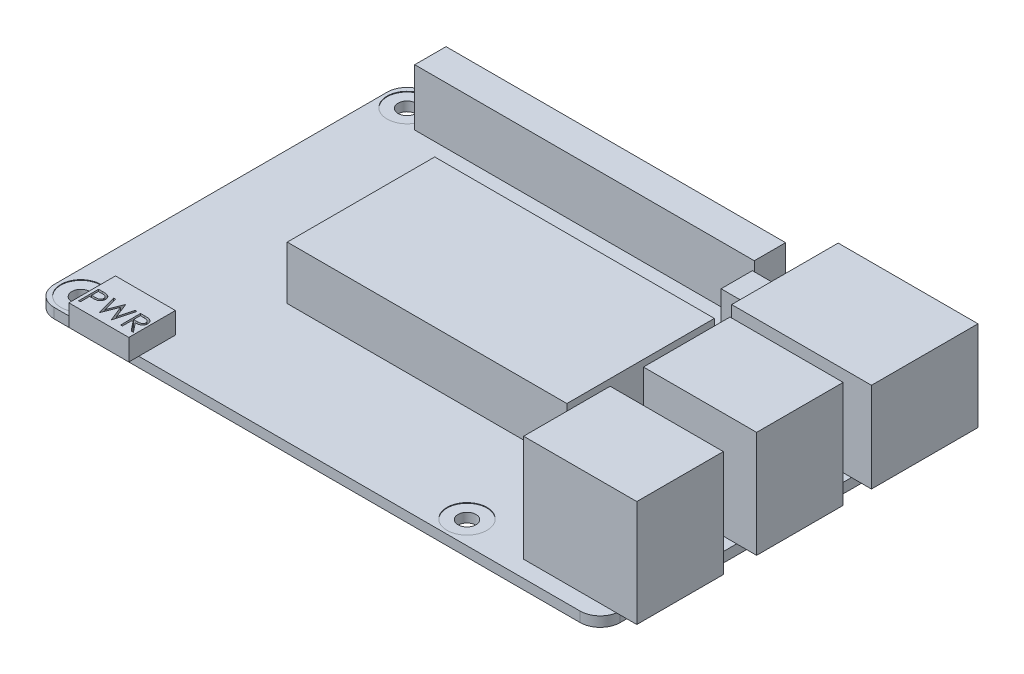
from build123d import *

# Parameters (mm, degrees)
SKETCH1_W           = 85
SKETCH1_H           = 56
SKETCH1_R           = 1.35
BOSS_EXTRUDE1_DEPTH = 1.5
FILLET1_R           = 3
SKETCH2_W           = 17
SKETCH2_H           = 13
BOSS_EXTRUDE2_DEPTH = 16
SKETCH3_W           = 21
SKETCH3_H           = 16
BOSS_EXTRUDE3_DEPTH = 13.5
SKETCH4_W           = 51
SKETCH4_H           = 4.7
SKETCH4_W_2         = 4.7
BOSS_EXTRUDE4_DEPTH = 8.5
SKETCH5_W           = 9
SKETCH5_H           = 7
BOSS_EXTRUDE5_DEPTH = 3.2
CUT_EXTRUDE1_DEPTH  = 1
SKETCH7_W           = 42
SKETCH7_H           = 22.15
BOSS_EXTRUDE6_DEPTH = 8
SKETCH9_R           = 3
CUT_EXTRUDE2_DEPTH  = 0.1


with BuildPart() as part:
    # Sketch1 → Boss-Extrude1 (new body)
    with BuildSketch(Plane(origin=(0, 0, 0), x_dir=(1, 0, 0), z_dir=(0, 1, 0))):
        with Locations((42.5, 28)):
            Rectangle(SKETCH1_W, SKETCH1_H)
        with Locations((3.5, 52.5)):
            Circle(SKETCH1_R, mode=Mode.SUBTRACT)
        with Locations((3.5, 3.5)):
            Circle(SKETCH1_R, mode=Mode.SUBTRACT)
        with Locations((61.5, 3.5)):
            Circle(SKETCH1_R, mode=Mode.SUBTRACT)
        with Locations((61.5, 52.5)):
            Circle(SKETCH1_R, mode=Mode.SUBTRACT)
    extrude(amount=BOSS_EXTRUDE1_DEPTH)

    # Fillet1
    fillet1_edges = [part.edges().sort_by_distance(p)[0] for p in [
        (85, 0.75, -56),
        (85, 0.75, 0),
        (0, 0.75, -56),
        (0, 0.75, 0),
    ]]
    fillet(fillet1_edges, radius=FILLET1_R)

    # Sketch2 → Boss-Extrude2 (add)
    with BuildSketch(Plane(origin=(0, 1.5, 0), x_dir=(1, 0, 0), z_dir=(0, 1, 0))):
        with Locations((79.5, 27)):
            Rectangle(SKETCH2_W, SKETCH2_H)
        with Locations((79.5, 9)):
            Rectangle(SKETCH2_W, SKETCH2_H)
    extrude(amount=BOSS_EXTRUDE2_DEPTH)

    # Sketch3 → Boss-Extrude3 (add)
    with BuildSketch(Plane(origin=(0, 1.5, 0), x_dir=(1, 0, 0), z_dir=(0, 1, 0))):
        with Locations((77.5, 45.75)):
            Rectangle(SKETCH3_W, SKETCH3_H)
    extrude(amount=BOSS_EXTRUDE3_DEPTH)

    # Sketch4 → Boss-Extrude4 (add)
    with BuildSketch(Plane(origin=(0, 1.5, 0), x_dir=(1, 0, 0), z_dir=(0, 1, 0))):
        with Locations((32.5, 52.5)):
            Rectangle(SKETCH4_W, SKETCH4_H)
        with Locations((61.5, 46.36)):
            Rectangle(SKETCH4_W_2, SKETCH4_H)
    extrude(amount=BOSS_EXTRUDE4_DEPTH)

    # Sketch5 → Boss-Extrude5 (add)
    with BuildSketch(Plane(origin=(0, 1.5, 0), x_dir=(1, 0, 0), z_dir=(0, 1, 0))):
        with Locations((11.2, 2)):
            Rectangle(SKETCH5_W, SKETCH5_H)
    extrude(amount=BOSS_EXTRUDE5_DEPTH)

    # Sketch6 → Cut-Extrude1 (cut)
    # profile 1 of 3: a face of its own
    with BuildSketch(Plane(origin=(0, 4.7, 0), x_dir=(1, 0, 0), z_dir=(0, 1, 0))):
        with BuildLine():
            Line((7.161538462, 2.5), (7.749879808, 2.5))
            add(Edge.make_bspline(
                [(7.749879808, 2.5), (7.790346299, 2.499955518), (7.867881893, 2.499870287), (7.979066226, 2.497286219), (8.080045996, 2.493834769), (8.170603465, 2.489050289), (8.251017264, 2.483396069), (8.32092352, 2.475465749), (8.380871712, 2.467185496), (8.416791525, 2.458767148), (8.433173077, 2.454927885)],
                knots=[0, 0, 0, 0, 1.415646017, 2.712440637, 3.8905458, 4.950247383, 5.884950622, 6.709939814, 7.411656543, 8, 8, 8, 8], degree=3))
            add(Edge.make_bspline(
                [(8.433173077, 2.454927885), (8.453910392, 2.449251928), (8.494896372, 2.43803376), (8.553954409, 2.415564855), (8.610143419, 2.388922999), (8.663656184, 2.358559622), (8.713835112, 2.323171995), (8.761428862, 2.284194609), (8.806017416, 2.24072755), (8.847350038, 2.193258344), (8.885308436, 2.142583879), (8.917991021, 2.087947682), (8.945357215, 2.030269422), (8.968828591, 1.969589218), (8.985721552, 1.905397512), (8.998447466, 1.83814033), (9.006524861, 1.767824881), (9.007298485, 1.719773566), (9.007692308, 1.6953125)],
                knots=[0, 0, 0, 0, 0.999701418, 1.975846123, 2.934577507, 3.890451536, 4.834027766, 5.787354733, 6.749476667, 7.726910423, 8.712836071, 9.690891519, 10.682875813, 11.679750201, 12.712814741, 13.765529915, 14.8625177, 16, 16, 16, 16], degree=3))
            add(Edge.make_bspline(
                [(9.007692308, 1.6953125), (9.007331086, 1.670645834), (9.006624333, 1.622383837), (8.998141803, 1.551778589), (8.986715924, 1.484305684), (8.969147022, 1.420114726), (8.946136445, 1.359586923), (8.919143257, 1.301797295), (8.886585945, 1.247729005), (8.849176091, 1.197185762), (8.807560439, 1.150120122), (8.761915063, 1.106873156), (8.712424241, 1.067698009), (8.659245257, 1.032506857), (8.601859672, 1.00211576), (8.541137826, 0.974895213), (8.476551927, 0.952034304), (8.431858343, 0.940008537), (8.409134615, 0.933894231)],
                knots=[0, 0, 0, 0, 1.121902311, 2.195077645, 3.232258892, 4.234102512, 5.217864754, 6.176164875, 7.132989551, 8.084763148, 9.034132444, 9.988522005, 10.94243251, 11.903244335, 12.886203696, 13.894208494, 14.929344452, 16, 16, 16, 16], degree=3))
            add(Edge.make_bspline(
                [(8.409134615, 0.933894231), (8.390339758, 0.92989739), (8.349149734, 0.921138081), (8.281313115, 0.911359403), (8.202331356, 0.903012888), (8.112312259, 0.89675477), (8.011336626, 0.891397312), (7.899349834, 0.887138946), (7.776132054, 0.884799071), (7.690185273, 0.884678391), (7.6453125, 0.884615385)],
                knots=[0, 0, 0, 0, 0.601384939, 1.31797006, 2.144135048, 3.087295005, 4.142315834, 5.309527816, 6.595305764, 8, 8, 8, 8], degree=3))
            Line((7.6453125, 0.884615385), (7.430769231, 0.884615385))
            Line((7.430769231, 0.884615385), (7.430769231, -0.5))
            Line((7.430769231, -0.5), (7.161538462, -0.5))
            Line((7.161538462, -0.5), (7.161538462, 2.5))
        make_face()
        with BuildLine():
            Line((7.430769231, 2.192307692), (7.430769231, 1.192307692))
            Line((7.430769231, 1.192307692), (7.956009615, 1.185697115))
            add(Edge.make_bspline(
                [(7.956009615, 1.185697115), (7.981655266, 1.185683861), (8.031163666, 1.185658273), (8.102680429, 1.189074179), (8.169031246, 1.193017493), (8.230012311, 1.198791142), (8.285651112, 1.206952219), (8.336040423, 1.215190852), (8.380789522, 1.227109734), (8.433160267, 1.243158079), (8.491517422, 1.270528893), (8.555003892, 1.31025737), (8.608807251, 1.360897977), (8.655365791, 1.417836118), (8.692313687, 1.481178229), (8.71936168, 1.548951603), (8.735254101, 1.620461188), (8.737385124, 1.669393879), (8.738461538, 1.694110577)],
                knots=[0, 0, 0, 0, 1.160613943, 2.240541288, 3.23993089, 4.169200891, 5.011653406, 5.7853311, 6.478053781, 7.106038997, 8.262395093, 9.384106736, 10.481365981, 11.59014053, 12.70357646, 13.786202915, 14.881775077, 16, 16, 16, 16], degree=3))
            add(Edge.make_bspline(
                [(8.738461538, 1.694110577), (8.73737927, 1.718229303), (8.735227854, 1.766174345), (8.719237115, 1.836441854), (8.692366274, 1.903501029), (8.655117764, 1.966049388), (8.609911082, 2.022782648), (8.557368788, 2.0720659), (8.497614564, 2.111684502), (8.442030366, 2.137255887), (8.39265792, 2.15286898), (8.349773383, 2.163793129), (8.301352805, 2.172515077), (8.247380423, 2.179577508), (8.188274565, 2.185623332), (8.123527438, 2.189725598), (8.053384315, 2.192126846), (8.00468954, 2.192245951), (7.979447115, 2.192307692)],
                knots=[0, 0, 0, 0, 1.120700087, 2.227813068, 3.331159281, 4.466773991, 5.599788987, 6.693661531, 7.80175334, 8.91857717, 9.525282508, 10.207424825, 10.974604443, 11.810962634, 12.737642355, 13.736264703, 14.826523623, 16, 16, 16, 16], degree=3))
            Line((7.979447115, 2.192307692), (7.430769231, 2.192307692))
        make_face(mode=Mode.SUBTRACT)
    # profile 2 of 3: a face of its own
    with BuildSketch(Plane(origin=(0, 4.7, 0), x_dir=(1, 0, 0), z_dir=(0, 1, 0))):
        Polygon((9.430769231, 2.5), (9.709014423, 2.5), (10.296153846, 0.299879808), (11.169350962, 2.5), (11.208413462, 2.5), (12.065384615, 0.314903846), (12.655528846, 2.5), (12.930769231, 2.5), (12.121875, -0.5), (12.083413462, -0.5), (11.180769231, 1.794471154), (10.267307692, -0.5), (10.228846154, -0.5), align=None)
    # profile 3 of 3: a face of its own
    with BuildSketch(Plane(origin=(0, 4.7, 0), x_dir=(1, 0, 0), z_dir=(0, 1, 0))):
        with BuildLine():
            Line((13.469230769, 2.5), (14.069591346, 2.5))
            add(Edge.make_bspline(
                [(14.069591346, 2.5), (14.109655171, 2.499866641), (14.186582152, 2.499610576), (14.296787812, 2.498182779), (14.396925324, 2.494090474), (14.486942329, 2.490568831), (14.566837176, 2.484147167), (14.636854854, 2.47800947), (14.69667288, 2.469974903), (14.73288361, 2.462513112), (14.749278846, 2.459134615)],
                knots=[0, 0, 0, 0, 1.410062039, 2.707475311, 3.878576406, 4.937260626, 5.877586885, 6.699081471, 7.410979367, 8, 8, 8, 8], degree=3))
            add(Edge.make_bspline(
                [(14.749278846, 2.459134615), (14.771227381, 2.453711674), (14.814656229, 2.442981476), (14.877184857, 2.420301818), (14.936768564, 2.394056426), (14.993159842, 2.36323038), (15.046076234, 2.327594854), (15.096063358, 2.287765035), (15.14334804, 2.243958859), (15.186018009, 2.195071852), (15.226251482, 2.143783415), (15.26018459, 2.088323052), (15.289435859, 2.030327457), (15.312724873, 1.969206813), (15.331477422, 1.905553866), (15.344699913, 1.83879204), (15.352629502, 1.76922549), (15.353436807, 1.721775854), (15.353846154, 1.697716346)],
                knots=[0, 0, 0, 0, 1.027469482, 2.033020251, 3.019912614, 3.986113645, 4.951240523, 5.91722682, 6.890402269, 7.87763091, 8.8651537, 9.85103654, 10.82876324, 11.815024772, 12.821070561, 13.842952187, 14.906261191, 16, 16, 16, 16], degree=3))
            add(Edge.make_bspline(
                [(15.353846154, 1.697716346), (15.352587013, 1.657743399), (15.350130102, 1.579745827), (15.32722287, 1.466550786), (15.289700139, 1.360959945), (15.237994463, 1.263106255), (15.172149198, 1.17489713), (15.093013663, 1.097419597), (15.00054371, 1.032585386), (14.914461439, 0.98762584), (14.838420696, 0.958831918), (14.775820714, 0.938572182), (14.707534733, 0.922919069), (14.634217018, 0.908896098), (14.555562456, 0.898308932), (14.471759565, 0.890554708), (14.382748578, 0.885708381), (14.321600804, 0.884986662), (14.290144231, 0.884615385)],
                knots=[0, 0, 0, 0, 1.260483769, 2.459530307, 3.627416485, 4.787058657, 5.939039949, 7.08810263, 8.267026773, 9.491475466, 10.141966685, 10.831826277, 11.566392101, 12.351337768, 13.187381173, 14.07005841, 15.007169909, 16, 16, 16, 16], degree=3))
            Line((14.290144231, 0.884615385), (15.392307692, -0.5))
            Line((15.392307692, -0.5), (15.059375, -0.5))
            Line((15.059375, -0.5), (13.957211538, 0.884615385))
            Line((13.957211538, 0.884615385), (13.738461538, 0.884615385))
            Line((13.738461538, 0.884615385), (13.738461538, -0.5))
            Line((13.738461538, -0.5), (13.469230769, -0.5))
            Line((13.469230769, -0.5), (13.469230769, 2.5))
        make_face()
        with BuildLine():
            Line((13.738461538, 2.192307692), (13.738461538, 1.192307692))
            Line((13.738461538, 1.192307692), (14.287740385, 1.188100962))
            add(Edge.make_bspline(
                [(14.287740385, 1.188100962), (14.313386132, 1.188089616), (14.363094896, 1.188067625), (14.435009751, 1.191490861), (14.501969847, 1.195385134), (14.563719063, 1.201341716), (14.620284985, 1.209018349), (14.671639339, 1.218620907), (14.717865955, 1.229808389), (14.771778988, 1.247124068), (14.831981729, 1.274557798), (14.897408694, 1.314471083), (14.953124984, 1.364673185), (15.000197437, 1.422079005), (15.038022664, 1.485195789), (15.064690139, 1.553266963), (15.081612233, 1.624574047), (15.083608129, 1.673583854), (15.084615385, 1.698317308)],
                knots=[0, 0, 0, 0, 1.146690395, 2.22261258, 3.21895312, 4.145990853, 4.996080663, 5.770904154, 6.481378293, 7.121626537, 8.300444488, 9.431385265, 10.535395872, 11.636531494, 12.74115979, 13.810798291, 14.895190096, 16, 16, 16, 16], degree=3))
            add(Edge.make_bspline(
                [(15.084615385, 1.698317308), (15.083584995, 1.722442942), (15.081543139, 1.770251147), (15.064872766, 1.840241927), (15.036681868, 1.906299313), (14.998691378, 1.968154586), (14.952406388, 2.024302359), (14.898133977, 2.072342776), (14.837358096, 2.111985175), (14.780554211, 2.137317501), (14.729782029, 2.152848804), (14.685699464, 2.163778373), (14.635889625, 2.172559346), (14.580110661, 2.179594827), (14.518600692, 2.185641922), (14.451048705, 2.189714875), (14.377902893, 2.192126758), (14.327205524, 2.192245977), (14.300961538, 2.192307692)],
                knots=[0, 0, 0, 0, 1.101028733, 2.181837193, 3.264309656, 4.369019818, 5.486613113, 6.575447106, 7.666700264, 8.788928104, 9.402425223, 10.0903467, 10.862060571, 11.710948788, 12.657782767, 13.684531032, 14.801375019, 16, 16, 16, 16], degree=3))
            Line((14.300961538, 2.192307692), (13.738461538, 2.192307692))
        make_face(mode=Mode.SUBTRACT)
    extrude(amount=-CUT_EXTRUDE1_DEPTH, mode=Mode.SUBTRACT)

    # Sketch7 → Boss-Extrude6 (add)
    with BuildSketch(Plane(origin=(0, 1.5, 0), x_dir=(1, 0, 0), z_dir=(0, 1, 0))):
        with Locations((41, 29.075)):
            Rectangle(SKETCH7_W, SKETCH7_H)
    extrude(amount=BOSS_EXTRUDE6_DEPTH)

    # Sketch9 → Cut-Extrude2 (cut)
    with BuildSketch(Plane(origin=(0, 1.5, 0), x_dir=(1, 0, 0), z_dir=(0, 1, 0))):
        with Locations((3.5, 52.5)):
            Circle(SKETCH9_R)
        with Locations((3.5, 3.5)):
            Circle(SKETCH9_R)
        with Locations((61.5, 52.5)):
            Circle(SKETCH9_R)
        with Locations((61.5, 3.5)):
            Circle(SKETCH9_R)
    extrude(amount=-CUT_EXTRUDE2_DEPTH, mode=Mode.SUBTRACT)


solid = part.part
